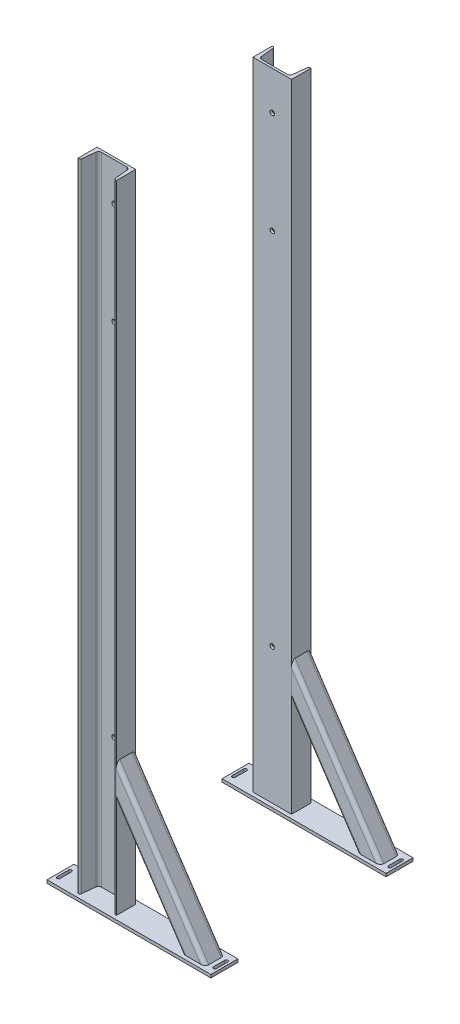
from build123d import *

# Parameters (mm, degrees)
CEOWNIK_C_100_X_10_1_DEPTH                     = 1650
SZKIC21_W                                      = 425
SZKIC21_H                                      = 70
DODANIE_WYCI_GNI_CIE1_DEPTH                    = 8
RURA_CIENKO_CIENNA_KWADRATOWA_TS2X2X0_18_DEPTH = 524.856349859
SZKIC59_W                                      = 6
SZKIC59_H                                      = 60
OTWORY_USTALAJ_CE_12_0MM1_AT_2_COUNT           = 2
OTWORY_USTALAJ_CE_12_0MM1_AT_2_PITCH           = 265
OTWORY_USTALAJ_CE_12_0MM1_AT_3_COUNT           = 2
OTWORY_USTALAJ_CE_12_0MM1_AT_3_PITCH           = 1198


# Read off the part's stored shape, not the designer's step: Przytnij/Wydłuż2, Przytnij/Wydłuż3
with BuildPart() as part:
    # Sketch118 → Ceownik c 100 X 10(1) (new body)
    with BuildSketch(Plane.ZX):
        with BuildLine():
            Line((50, 100), (0, 100))
            Line((0, 100), (0, 0))
            Line((0, 0), (50, 0))
            Line((50, 0), (50, 1.629852671))
            ThreePointArc((50, 1.629852671), (48.844151715, 4.6409404), (45.970378085, 6.1052012))
            Line((45.970378085, 6.1052012), (13.063772294, 9.563824837))
            ThreePointArc((13.063772294, 9.563824837), (7.954841396, 12.166955149), (5.9, 17.52))
            Line((5.9, 17.52), (5.9, 82.48))
            ThreePointArc((5.9, 82.48), (7.954841396, 87.833044851), (13.063772294, 90.436175163))
            Line((13.063772294, 90.436175163), (45.970378085, 93.8947988))
            ThreePointArc((45.970378085, 93.8947988), (48.844151715, 95.3590596), (50, 98.370147329))
            Line((50, 98.370147329), (50, 100))
        make_face()
    extrude(amount=CEOWNIK_C_100_X_10_1_DEPTH)

    # Szkic59 → Otwory ustalające Ø12.0mm1 (revolve, cut)
    with BuildSketch(Plane(origin=(50, 1550, 0), x_dir=(0, 1, 0), z_dir=(1, 0, 0))):
        with Locations((3, 30)):
            Rectangle(SZKIC59_W, SZKIC59_H)
    otwory_ustalaj_ce_12_0mm1 = revolve(axis=Axis((50, 1550, -6.35), (0, 0, 1)), mode=Mode.SUBTRACT)

    # Otwory ustalające Ø12.0mm1 at 2: Otwory ustalające Ø12.0mm1 ×2
    with Locations(*[(0, -i * OTWORY_USTALAJ_CE_12_0MM1_AT_2_PITCH, 0) for i in range(1, OTWORY_USTALAJ_CE_12_0MM1_AT_2_COUNT)]):
        add(otwory_ustalaj_ce_12_0mm1, mode=Mode.SUBTRACT)

    # Otwory ustalające Ø12.0mm1 at 3: Otwory ustalające Ø12.0mm1 ×2
    with Locations(*[(0, -i * OTWORY_USTALAJ_CE_12_0MM1_AT_3_PITCH, 0) for i in range(1, OTWORY_USTALAJ_CE_12_0MM1_AT_3_COUNT)]):
        add(otwory_ustalaj_ce_12_0mm1, mode=Mode.SUBTRACT)


with BuildPart() as body_2:
    # Szkic21 → Dodanie-wyciągnięcie1 (new body)
    with BuildSketch(Plane.XZ):
        with Locations((142.5, 25)):
            Rectangle(SZKIC21_W, SZKIC21_H)
        with BuildLine():
            Line((-56, 40), (-56, 10))
            ThreePointArc((-56, 10), (-60, 6), (-64, 10))
            Line((-64, 10), (-64, 40))
            ThreePointArc((-64, 40), (-60, 44), (-56, 40))
        make_face(mode=Mode.SUBTRACT)
        with BuildLine():
            Line((349, 39.822910334), (349, 10.177089666))
            ThreePointArc((349, 10.177089666), (345, 6.177089666), (341, 10.177089666))
            Line((341, 10.177089666), (341, 39.822910334))
            ThreePointArc((341, 39.822910334), (345, 43.822910334), (349, 39.822910334))
        make_face(mode=Mode.SUBTRACT)
    extrude(amount=DODANIE_WYCI_GNI_CIE1_DEPTH)


with BuildPart() as body_3:
    # Sketch1 → Rura cienkościenna kwadratowa TS2X2X0.1875(1) (new body)
    with BuildSketch(Plane(origin=(339.472914964, -59.209372446, 25), x_dir=(0.8320502943378437, 0.5547001962252293, 0), z_dir=(-0.5547001962252293, 0.8320502943378437, 0))):
        with BuildLine():
            Line((-15.875, -25.4), (15.875, -25.4))
            ThreePointArc((15.875, -25.4), (22.610192091, -22.610192091), (25.4, -15.875))
            Line((25.4, -15.875), (25.4, 15.875))
            ThreePointArc((25.4, 15.875), (22.610192091, 22.610192091), (15.875, 25.4))
            Line((15.875, 25.4), (-15.875, 25.4))
            ThreePointArc((-15.875, 25.4), (-22.610192091, 22.610192091), (-25.4, 15.875))
            Line((-25.4, 15.875), (-25.4, -15.875))
            ThreePointArc((-25.4, -15.875), (-22.610192091, -22.610192091), (-15.875, -25.4))
        make_face()
        with BuildLine():
            Line((-15.875, -20.6375), (15.875, -20.6375))
            ThreePointArc((15.875, -20.6375), (19.242596045, -19.242596045), (20.6375, -15.875))
            Line((20.6375, -15.875), (20.6375, 15.875))
            ThreePointArc((20.6375, 15.875), (19.242596045, 19.242596045), (15.875, 20.6375))
            Line((15.875, 20.6375), (-15.875, 20.6375))
            ThreePointArc((-15.875, 20.6375), (-19.242596045, 19.242596045), (-20.6375, 15.875))
            Line((-20.6375, 15.875), (-20.6375, -15.875))
            ThreePointArc((-20.6375, -15.875), (-19.242596045, -19.242596045), (-15.875, -20.6375))
        make_face(mode=Mode.SUBTRACT)
    extrude(amount=RURA_CIENKO_CIENNA_KWADRATOWA_TS2X2X0_18_DEPTH)


with BuildPart() as body_4:
    # Przytnij/Wydłuż2: the piece on the far side of the plane
    add(body_3.part)
    split(bisect_by=Plane(origin=(0, 0, 0), x_dir=(1, 0, 0), z_dir=(0, 1, 0)), keep=Keep.BOTTOM)


with BuildPart() as body_3_1:
    add(body_3.part)

    # Przytnij/Wydłuż2
    split(bisect_by=Plane(origin=(0, 0, 0), x_dir=(1, 0, 0), z_dir=(0, 1, 0)), keep=Keep.TOP)


with BuildPart() as body_4_2:
    # Przytnij/Wydłuż3: the piece on the far side of the plane
    add(body_3_1.part)
    split(bisect_by=Plane.YZ.offset(100), keep=Keep.BOTTOM)


with BuildPart() as body_3_2:
    add(body_3_1.part)

    # Przytnij/Wydłuż3
    split(bisect_by=Plane.YZ.offset(100), keep=Keep.TOP)


with BuildPart() as body_4_3:
    # Lustro3: mirrored copy
    add(part.part.mirror(Plane(origin=(0, 0, -202), x_dir=(1, 0, 0), z_dir=(0, 0, -1))))


with BuildPart() as body_5:
    # Lustro3 2: mirrored copy
    add(body_3_2.part.mirror(Plane(origin=(0, 0, -202), x_dir=(1, 0, 0), z_dir=(0, 0, -1))))


with BuildPart() as body_6:
    # Lustro3 3: mirrored copy
    add(body_2.part.mirror(Plane(origin=(0, 0, -202), x_dir=(1, 0, 0), z_dir=(0, 0, -1))))


solid = Compound([part.part, body_2.part, body_3_2.part, body_4_3.part, body_5.part, body_6.part])
